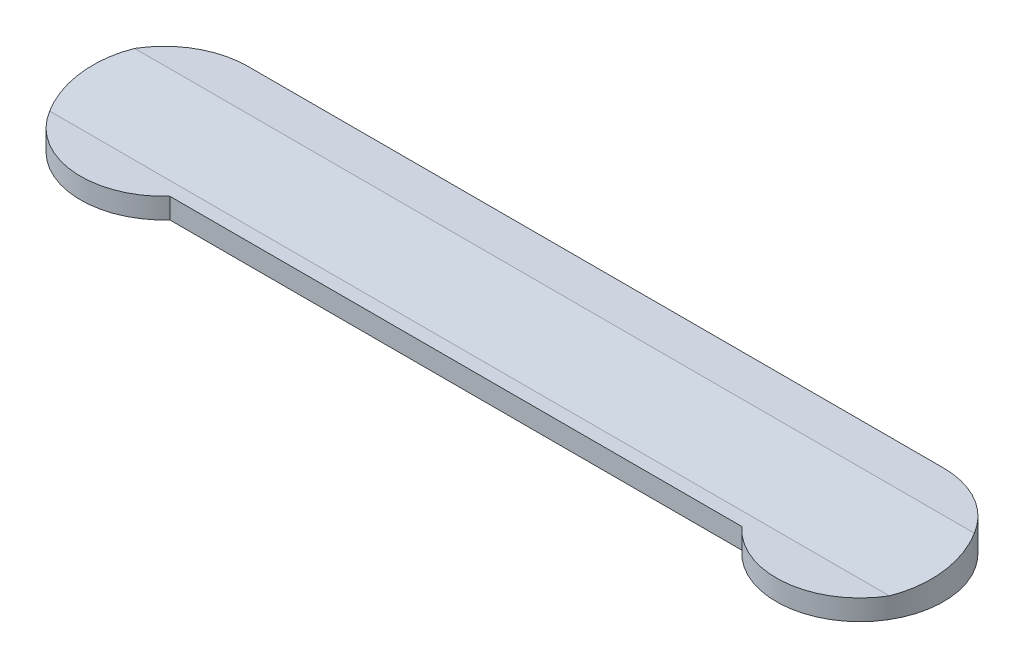
from build123d import *

# Parameters (mm, degrees)
BOSS_EXTRUDE1_DEPTH     = 15
CUT_EXTRUDE2_DEPTH      = 246.365543628
CUT_EXTRUDE2_DEPTH_BACK = 246.365543628
CUT_EXTRUDE3_DEPTH      = 5
CUT_EXTRUDE4_DEPTH      = 192.302
CUT_EXTRUDE4_DEPTH_BACK = 21
FILLET1_R               = 6.35
SKETCH5_R               = 5.08
CUT_EXTRUDE5_DEPTH      = 7.62


with BuildPart() as part:
    # Sketch1 → Boss-Extrude1 (new body)
    with BuildSketch(Plane(origin=(0, 0, 0), x_dir=(1, 0, 0), z_dir=(0, 1, 0))):
        with BuildLine():
            Line((212.5, 30.5), (-41.5, 30.5))
            ThreePointArc((-41.5, 30.5), (-69.388169535, -12.349089035), (-18.916820419, -20.5))
            Line((-18.916820419, -20.5), (189.916820419, -20.5))
            ThreePointArc((189.916820419, -20.5), (240.388169535, -12.349089035), (212.5, 30.5))
        make_face()
    extrude(amount=BOSS_EXTRUDE1_DEPTH)

    # Sketch3 → Cut-Extrude2 (cut, two sides: drawn at the far end of the back side and taken through both)
    with BuildSketch(Plane(origin=(0, 0, 0), x_dir=(0, 0, -1), z_dir=(1, 0, 0)).offset(-CUT_EXTRUDE2_DEPTH_BACK)):
        Polygon((-30.5, 7.5), (-15.5, 7.5), (15.5, 11.817894466), (30.5, 11.817894466), (30.5, 24.944293644), (-30.5, 24.944293644), align=None)
    extrude(amount=CUT_EXTRUDE2_DEPTH + CUT_EXTRUDE2_DEPTH_BACK, mode=Mode.SUBTRACT)

    # Sketch2 → Cut-Extrude3 (cut)
    with BuildSketch(Plane(origin=(0, 0, 0), x_dir=(1, 0, 0), z_dir=(0, 1, 0))):
        with BuildLine():
            Line((212.5, 25.5), (-41.5, 25.5))
            ThreePointArc((-41.5, 25.5), (-64.36372673, -11.291589791), (-21.251543269, -15.5))
            Line((-21.251543269, -15.5), (192.251543269, -15.5))
            ThreePointArc((192.251543269, -15.5), (235.36372673, -11.291589791), (212.5, 25.5))
        make_face()
    extrude(amount=CUT_EXTRUDE3_DEPTH, mode=Mode.SUBTRACT)

    # Sketch4 → Cut-Extrude4 (cut, two sides: drawn at the far end of the back side and taken through both)
    with BuildSketch(Plane(origin=(0, 0, 0), x_dir=(0, 0, -1), z_dir=(1, 0, 0)).offset(-CUT_EXTRUDE4_DEPTH_BACK)):
        Polygon((25.5, 5), (25.5, 9.317894466), (15.5, 9.317894466), (-15.5, 5), align=None)
    extrude(amount=CUT_EXTRUDE4_DEPTH + CUT_EXTRUDE4_DEPTH_BACK, mode=Mode.SUBTRACT)

    # Fillet1
    fillet1_edges = [part.edges().sort_by_distance(p)[0] for p in [
        (85.651, 9.317894466, -15.5),
    ]]
    fillet(fillet1_edges, radius=FILLET1_R)

    # Sketch5 → Cut-Extrude5 (cut)
    with BuildSketch(Plane(origin=(0, 0, -30.5), x_dir=(-1, 0, 0), z_dir=(0, 0, -1))):
        with Locations((-161.7, 0)):
            Circle(SKETCH5_R)
        with Locations((-110.9, 0)):
            Circle(SKETCH5_R)
        with Locations((-60.1, 0)):
            Circle(SKETCH5_R)
        with Locations((-9.3, 0)):
            Circle(SKETCH5_R)
    extrude(amount=-CUT_EXTRUDE5_DEPTH, mode=Mode.SUBTRACT)


solid = part.part
